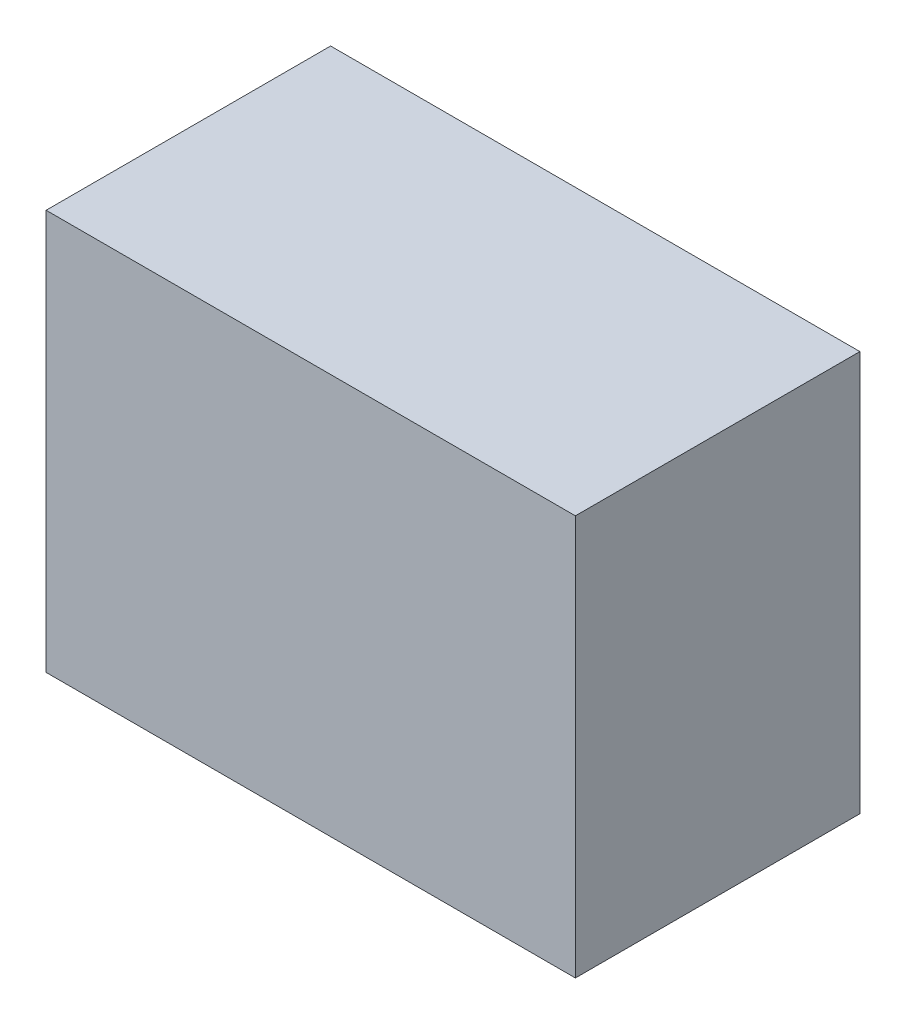
from build123d import *

# Parameters (mm, degrees)
SKETCH2_W           = 320
SKETCH2_H           = 172
BOSS_EXTRUDE1_DEPTH = 242


with BuildPart() as part:
    # Sketch2 → Boss-Extrude1 (new body)
    with BuildSketch(Plane(origin=(0, 0, 0), x_dir=(1, 0, 0), z_dir=(0, 1, 0))):
        Rectangle(SKETCH2_W, SKETCH2_H)
    extrude(amount=BOSS_EXTRUDE1_DEPTH)


solid = part.part
